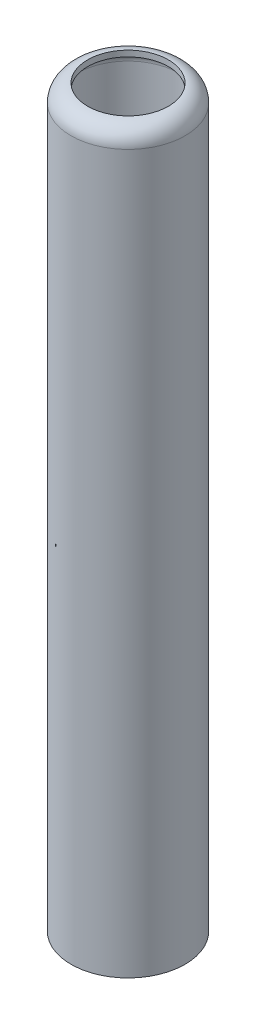
from build123d import *

# Parameters (mm, degrees)
SKETCH1_R           = 14.5
BASE_DEPTH          = 186.69
TOP_FILLET_R        = 4.365625
CASING_WALLS_T      = -1.5
TOP_HOLE_DEPTH      = 188.812821987
TOP_HOLE_DEPTH_BACK = 188.812821987
SKETCH2_R           = 10.25


with BuildPart() as part:
    # Sketch1 → base (new body)
    with BuildSketch(Plane(origin=(0, 0, 0), x_dir=(1, 0, 0), z_dir=(0, 1, 0))):
        Circle(SKETCH1_R)
    extrude(amount=BASE_DEPTH)

    # top-fillet
    top_fillet_edges = [part.edges().sort_by_distance(p)[0] for p in [
        (-14.5, 186.69, 0),
    ]]
    fillet(top_fillet_edges, radius=TOP_FILLET_R)

    # casing-walls
    casing_walls_openings = [part.faces().sort_by_distance(p)[0] for p in [
        (0, 0, 0),
    ]]
    offset(amount=CASING_WALLS_T, openings=casing_walls_openings, kind=Kind.INTERSECTION)

    # Sketch2 → top-hole (cut, two sides: drawn at the far end of the back side and taken through both)
    with BuildSketch(Plane(origin=(0, 0, 0), x_dir=(1, 0, 0), z_dir=(0, 1, 0)).offset(-TOP_HOLE_DEPTH_BACK)):
        Circle(SKETCH2_R)
    extrude(amount=TOP_HOLE_DEPTH + TOP_HOLE_DEPTH_BACK, mode=Mode.SUBTRACT)


solid = part.part
